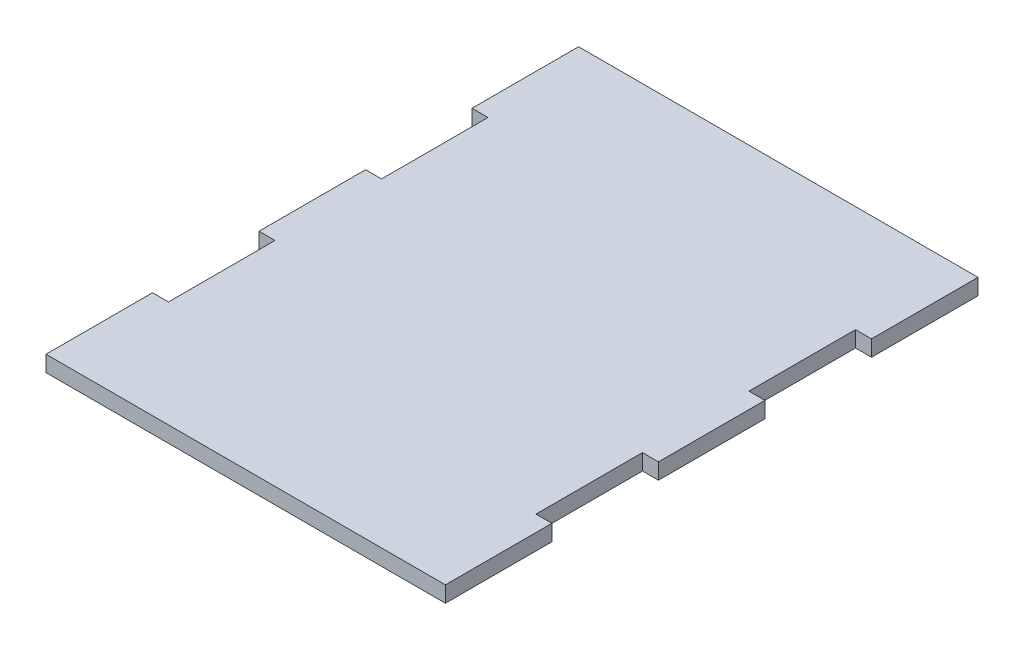
from build123d import *

# Parameters (mm, degrees)
SKETCH1_W           = 150
SKETCH1_H           = 200
BOSS_EXTRUDE1_DEPTH = 6
SKETCH2_W           = 6
SKETCH2_H           = 40
CUT_EXTRUDE1_DEPTH  = 6


with BuildPart() as part:
    # Sketch1 → Boss-Extrude1 (new body)
    with BuildSketch(Plane(origin=(0, 0, 0), x_dir=(1, 0, 0), z_dir=(0, 1, 0))):
        Rectangle(SKETCH1_W, SKETCH1_H)
    extrude(amount=BOSS_EXTRUDE1_DEPTH)

    # Sketch2 → Cut-Extrude1 (cut)
    with BuildSketch(Plane(origin=(0, 6, 0), x_dir=(1, 0, 0), z_dir=(0, 1, 0))):
        with Locations((-72, 40)):
            Rectangle(SKETCH2_W, SKETCH2_H)
        with Locations((72, 40)):
            Rectangle(SKETCH2_W, SKETCH2_H)
        with Locations((72, -40)):
            Rectangle(SKETCH2_W, SKETCH2_H)
        with Locations((-72, -40)):
            Rectangle(SKETCH2_W, SKETCH2_H)
    extrude(amount=-CUT_EXTRUDE1_DEPTH, mode=Mode.SUBTRACT)


solid = part.part
